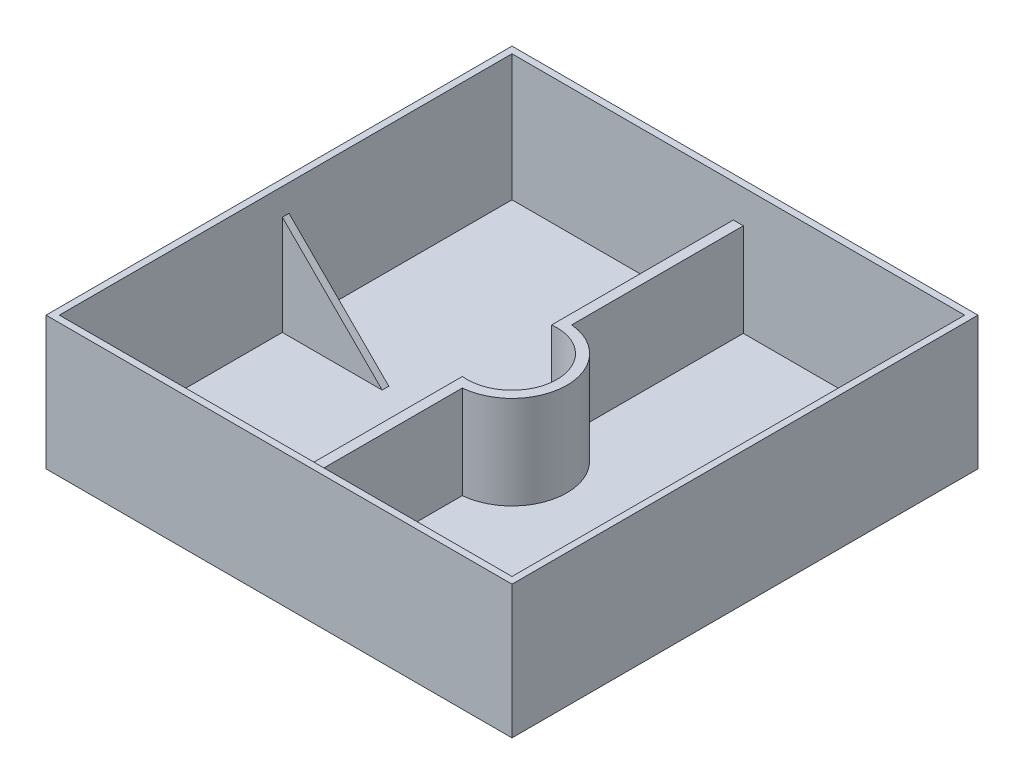
from build123d import *

# Parameters (mm, degrees)
SKETCH1_W           = 177.8
SKETCH1_H           = 177.8
BOSS_EXTRUDE1_DEPTH = 50.8
SHELL1_T            = -2.54
RIB3_START          = -1.27
RIB3_DEPTH          = 2.54
RIB7_REACH          = 133.37


# Read off the part's stored shape, not the designer's step: Rib3
with BuildPart() as part:
    # Sketch1 → Boss-Extrude1 (new body)
    with BuildSketch(Plane(origin=(0, 0, 0), x_dir=(1, 0, 0), z_dir=(0, 1, 0))):
        Rectangle(SKETCH1_W, SKETCH1_H)
    extrude(amount=BOSS_EXTRUDE1_DEPTH)

    # Shell1
    shell1_openings = [part.faces().sort_by_distance(p)[0] for p in [
        (0, 50.8, 0),
    ]]
    offset(amount=SHELL1_T, openings=shell1_openings, kind=Kind.INTERSECTION)

    # Rib3 outline → Rib3 (add)
    with BuildSketch(Plane.XY.offset(RIB3_START)):
        Polygon((-48.26, 2.54), (-86.36, 40.64), (-86.36, 2.54), align=None)
    rib3 = extrude(amount=RIB3_DEPTH)

    # Mirror1: Rib3 across plane
    add(rib3.mirror(Plane(origin=(0, 0, 0), x_dir=(0, 0, 1), z_dir=(1, 0, 0))))

    # Sketch5 walls → Rib7 (add, up to next)
    with BuildSketch(Plane(origin=(0, 38.1, 0), x_dir=(-1, 0, 0), z_dir=(0, -1, 0)), mode=Mode.PRIVATE) as rib7_sk1:
        with BuildLine():
            Line((-1.905, 218.729821496), (-1.905, 20.868229441))
            ThreePointArc((-1.905, 20.868229441), (-20.955, 0), (-1.905, -20.868229441))
            Line((-1.905, -20.868229441), (-1.905, -218.729821496))
            Line((-1.905, -218.729821496), (1.905, -218.729821496))
            Line((1.905, -218.729821496), (1.905, -17.038837989))
            ThreePointArc((1.905, -17.038837989), (-17.145, 0), (1.905, 17.038837989))
            Line((1.905, 17.038837989), (1.905, 218.729821496))
            Line((1.905, 218.729821496), (-1.905, 218.729821496))
        make_face()
    rib7_tool1 = extrude(rib7_sk1.sketch, amount=RIB7_REACH, mode=Mode.PRIVATE) - part.part
    add(rib7_tool1.solids().sort_by_distance((19.05, 38.1, 0))[0])


solid = part.part
